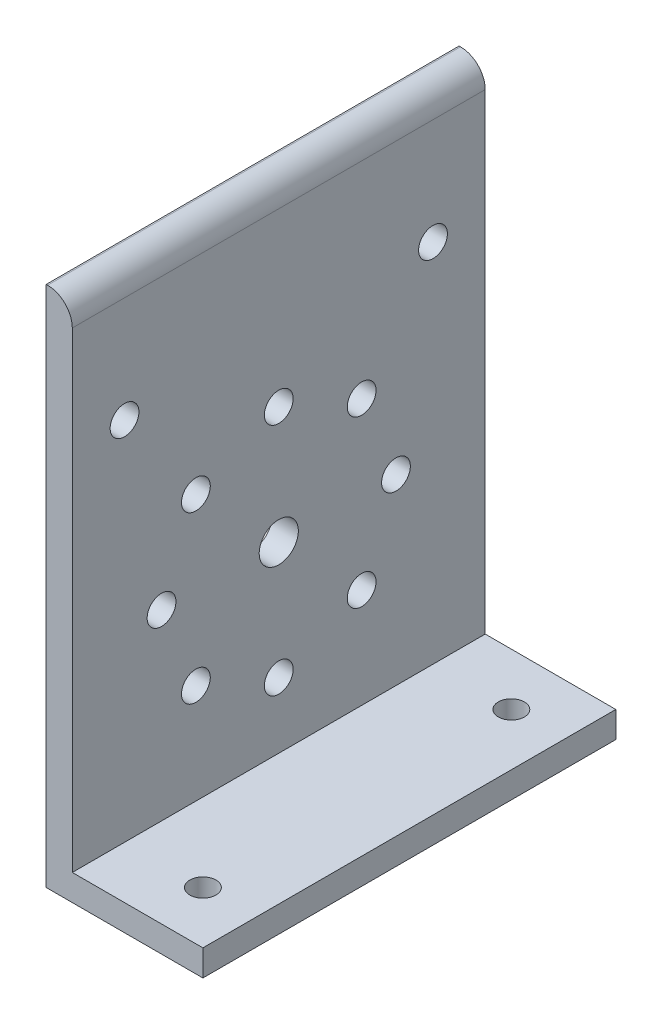
from build123d import *

# Parameters (mm, degrees)
BOSS_EXTRUDE1_DEPTH = 100.4
SKETCH2_R           = 3.5
SKETCH2_R_2         = 4.7625
CUT_EXTRUDE1_DEPTH  = 167.315272901
SKETCH3_R           = 3.175
CUT_EXTRUDE2_DEPTH  = 162.518396785
SKETCH5_R           = 3.5
CUT_EXTRUDE4_DEPTH  = 10


with BuildPart() as part:
    # Sketch1 → Boss-Extrude1 (new body)
    with BuildSketch(Plane.XY):
        with BuildLine():
            Line((0, 6.35), (0, 0))
            Line((0, 0), (38.1, 0))
            Line((38.1, 0), (38.1, 0.35))
            Line((38.1, 0.35), (38.1, 6.35))
            Line((38.1, 6.35), (32.1, 6.35))
            Line((32.1, 6.35), (6.35, 6.35))
            Line((6.35, 6.35), (6.35, 37.75))
            Line((6.35, 37.75), (6.35, 121))
            ThreePointArc((6.35, 121), (4.592640687, 125.242640687), (0.35, 127))
            Line((0.35, 127), (0, 127))
            Line((0, 127), (0, 6.35))
        make_face()
    extrude(amount=BOSS_EXTRUDE1_DEPTH)

    # Sketch2 → Cut-Extrude1 (cut, through all)
    with BuildSketch(Plane.ZY):
        with Locations((50.2, 79.3)):
            Circle(SKETCH2_R)
        with Locations((50.2, 22.3)):
            Circle(SKETCH2_R)
        with Locations((50.2, 50.8)):
            Circle(SKETCH2_R_2)
        with Locations((70.352543264, 70.952543264)):
            Circle(SKETCH2_R)
        with Locations((78.7, 50.8)):
            Circle(SKETCH2_R)
        with Locations((70.352543264, 30.647456736)):
            Circle(SKETCH2_R)
        with Locations((30.047456736, 30.647456736)):
            Circle(SKETCH2_R)
        with Locations((21.7, 50.8)):
            Circle(SKETCH2_R)
        with Locations((30.047456736, 70.952543264)):
            Circle(SKETCH2_R)
    extrude(amount=-CUT_EXTRUDE1_DEPTH, mode=Mode.SUBTRACT)

    # Sketch3 → Cut-Extrude2 (cut, through all)
    with BuildSketch(Plane(origin=(0, 6.35, 0), x_dir=(1, 0, 0), z_dir=(0, 1, 0))):
        with Locations((25.4, -12.7)):
            Circle(SKETCH3_R)
        with Locations((25.4, -87.7)):
            Circle(SKETCH3_R)
    extrude(amount=-CUT_EXTRUDE2_DEPTH, mode=Mode.SUBTRACT)

    # Sketch5 → Cut-Extrude4 (cut)
    with BuildSketch(Plane(origin=(6.35, 0, 0), x_dir=(0, 0, -1), z_dir=(1, 0, 0))):
        with Locations((-87.7, 95.25)):
            Circle(SKETCH5_R)
        with Locations((-12.7, 95.25)):
            Circle(SKETCH5_R)
    extrude(amount=-CUT_EXTRUDE4_DEPTH, mode=Mode.SUBTRACT)


solid = part.part
